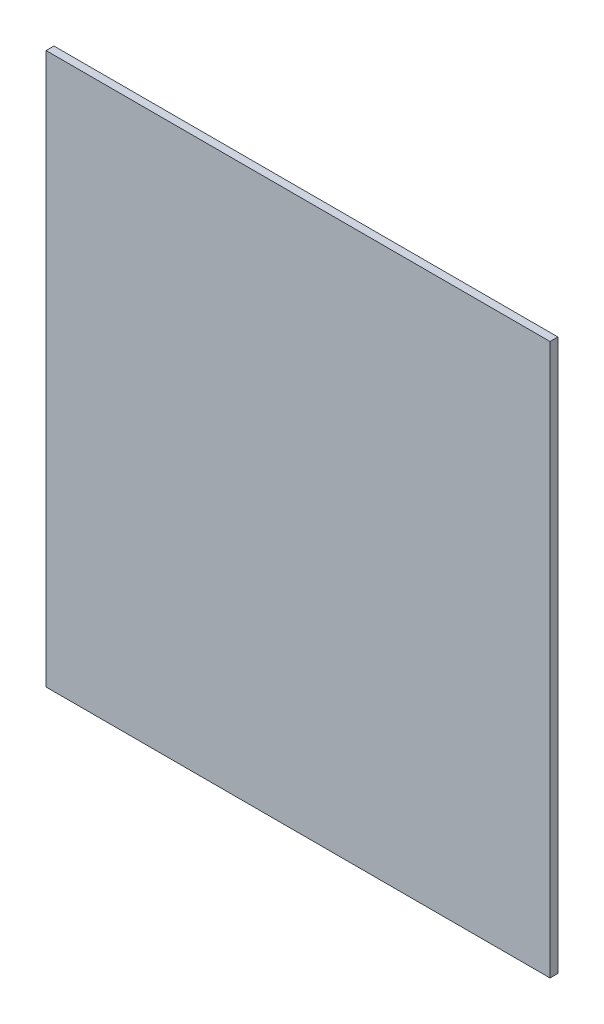
from build123d import *

# Parameters (mm, degrees)
SKETCH1_W          = 320
SKETCH1_H          = 350
BASE_FLANGE1_DEPTH = 5


# Sheet-metal steps are written as plain solids
with BuildPart() as part:
    # Sketch1 → Base-Flange1 (new body)
    with BuildSketch(Plane.XY):
        Rectangle(SKETCH1_W, SKETCH1_H)
    extrude(amount=-BASE_FLANGE1_DEPTH)


solid = part.part
